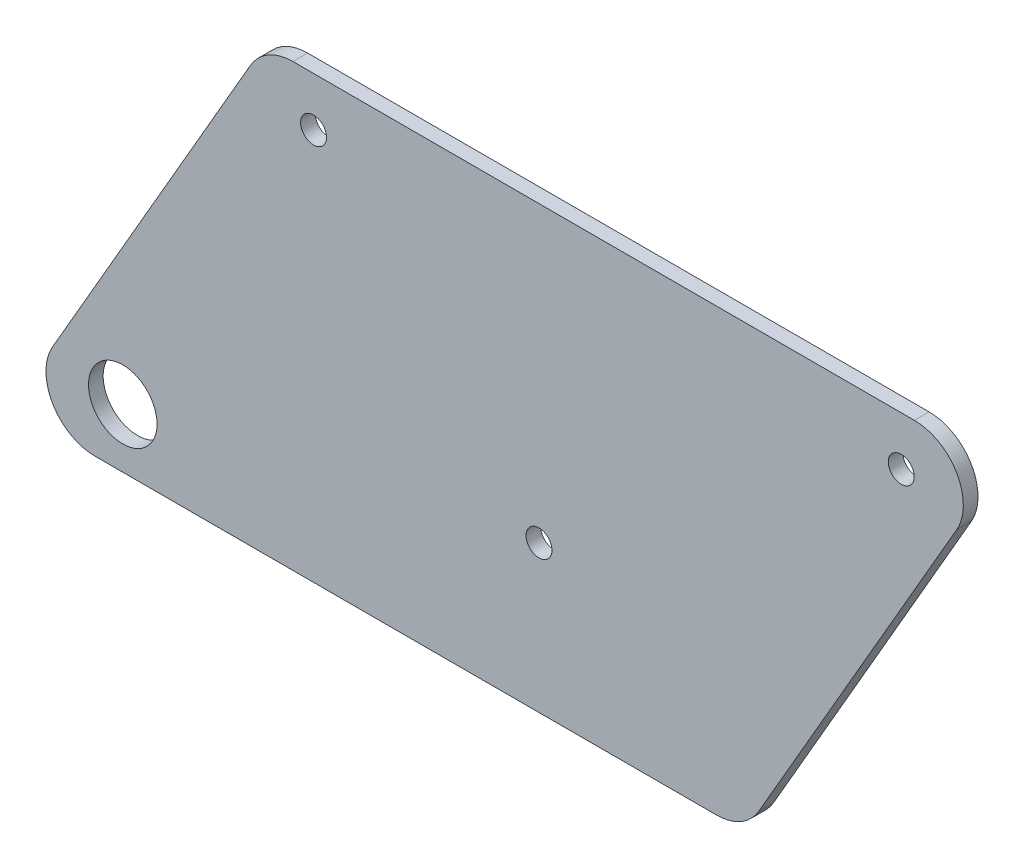
from build123d import *

# Parameters (mm, degrees)
BOSS_EXTRUDE1_DEPTH = 3
SKETCH2_R           = 7
SKETCH2_R_2         = 2.65
CUT_EXTRUDE1_DEPTH  = 3
FILLET1_R           = 10


with BuildPart() as part:
    # Sketch1 → Boss-Extrude1 (new body)
    with BuildSketch(Plane.XY):
        Polygon((0, 0), (51.961524227, 90), (201.961524227, 90), (150, 0), align=None)
    extrude(amount=BOSS_EXTRUDE1_DEPTH)

    # Sketch2 → Cut-Extrude1 (cut)
    with BuildSketch(Plane.XY.offset(3)):
        with Locations((23, 12)):
            Circle(SKETCH2_R)
        with Locations((108, 30)):
            Circle(SKETCH2_R_2)
        with Locations((61.961524227, 80)):
            Circle(SKETCH2_R_2)
        with Locations((181.961524227, 80)):
            Circle(SKETCH2_R_2)
    extrude(amount=-CUT_EXTRUDE1_DEPTH, mode=Mode.SUBTRACT)

    # Fillet1
    fillet1_edges = [part.edges().sort_by_distance(p)[0] for p in [
        (150, 0, 1.5),
        (201.961524227, 90, 1.5),
        (51.961524227, 90, 1.5),
        (0, 0, 1.5),
    ]]
    fillet(fillet1_edges, radius=FILLET1_R)


solid = part.part
